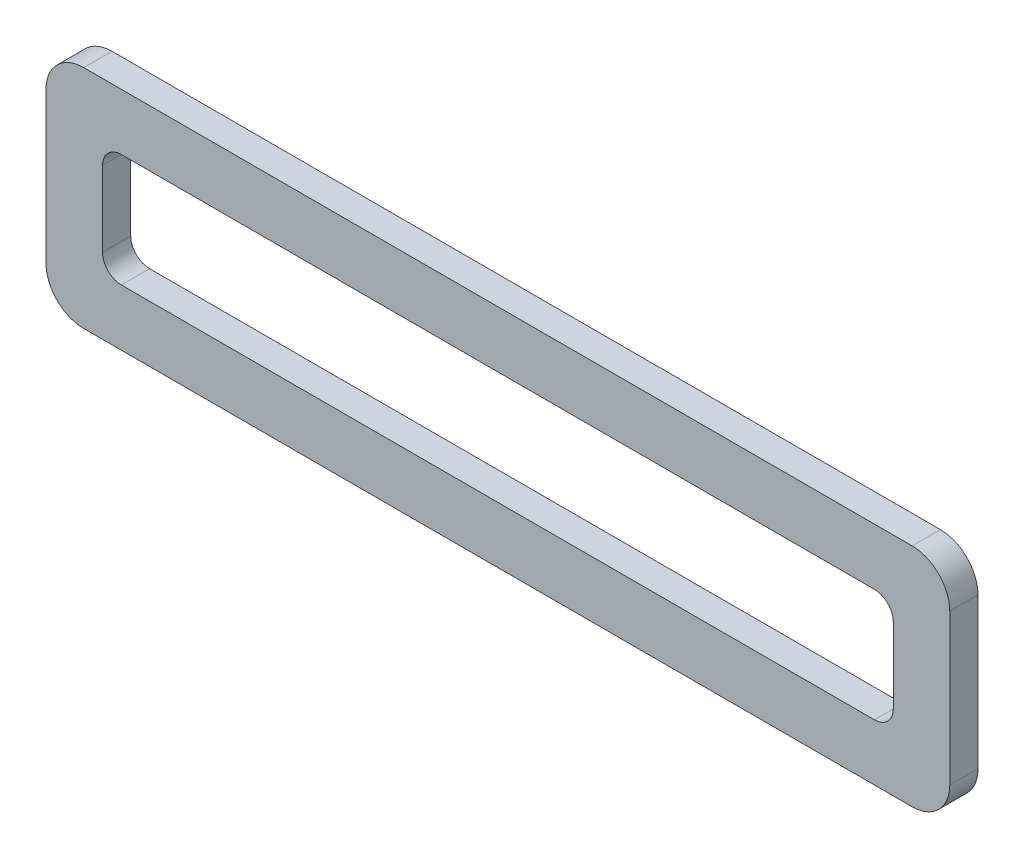
from build123d import *

# Parameters (mm, degrees)
SKETCH1_W           = 304.8
SKETCH1_H           = 76.2
SKETCH1_W_2         = 266.7
SKETCH1_H_2         = 38.1
BOSS_EXTRUDE1_DEPTH = 9.525
FILLET1_R           = 12.7
FILLET2_R           = 6.35


with BuildPart() as part:
    # Sketch1 → Boss-Extrude1 (new body)
    with BuildSketch(Plane.XY):
        Rectangle(SKETCH1_W, SKETCH1_H)
        Rectangle(SKETCH1_W_2, SKETCH1_H_2, mode=Mode.SUBTRACT)
    extrude(amount=BOSS_EXTRUDE1_DEPTH)

    # Fillet1
    fillet1_edges = [part.edges().sort_by_distance(p)[0] for p in [
        (-152.4, -38.1, 4.7625),
        (152.4, -38.1, 4.7625),
        (152.4, 38.1, 4.7625),
        (-152.4, 38.1, 4.7625),
    ]]
    fillet(fillet1_edges, radius=FILLET1_R)

    # Fillet2
    fillet2_edges = [part.edges().sort_by_distance(p)[0] for p in [
        (133.35, 19.05, 4.7625),
        (133.35, -19.05, 4.7625),
        (-133.35, -19.05, 4.7625),
        (-133.35, 19.05, 4.7625),
    ]]
    fillet(fillet2_edges, radius=FILLET2_R)


solid = part.part
